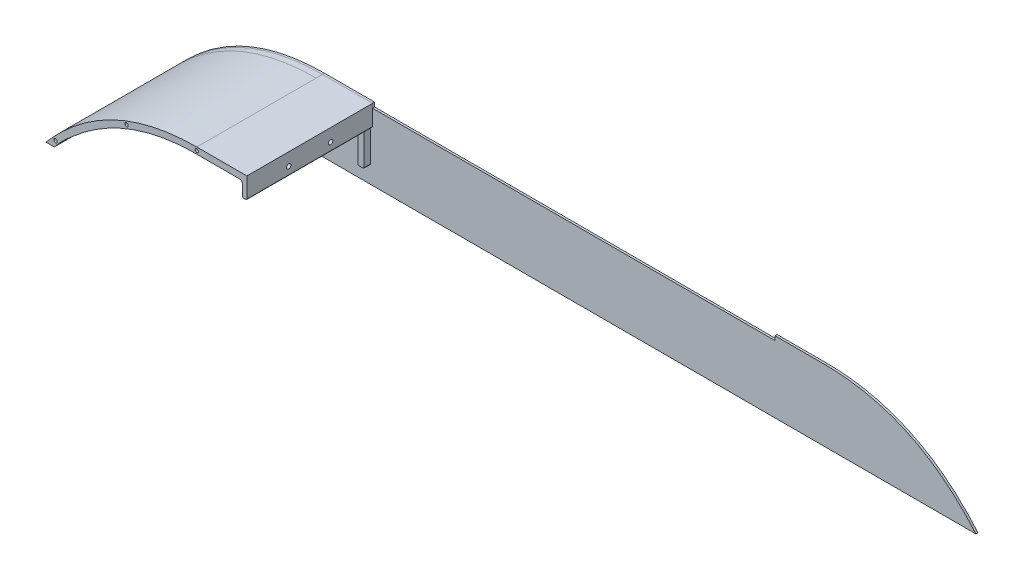
from build123d import *

# Parameters (mm, degrees)
BOSS_EXTRUDE1_DEPTH = 3.175
CUT_EXTRUDE1_DEPTH  = 921.755474233
BOSS_EXTRUDE2_DEPTH = 9.525
BOSS_EXTRUDE3_DEPTH = 180.975
SKETCH6_W           = 28.082698006
SKETCH6_H           = 28.575
CUT_EXTRUDE2_DEPTH  = 9.525
SKETCH7_R           = 3.275
CUT_EXTRUDE3_DEPTH  = 939.366939617
SKETCH8_R           = 3.325
CUT_EXTRUDE5_DEPTH  = 6.35
SKETCH9_R           = 2.6
SKETCH9_R_2         = 2.600000001
CUT_EXTRUDE6_DEPTH  = 12.7
SKETCH11_R          = 1.9
BOSS_EXTRUDE5_DEPTH = 10.16
SKETCH14_W          = 12.7
SKETCH14_H          = 9.525
BOSS_EXTRUDE8_DEPTH = 57.150234853
SKETCH17_W          = 9.525
SKETCH17_H          = 50.8
CUT_EXTRUDE9_DEPTH  = 3.175
FILLET1_R           = 5
FILLET2_R           = 2
FILLET3_R           = 1
FILLET8_R           = 5
FILLET9_R           = 1.5
FILLET10_R          = 1.5


# Read off the part's stored shape, not the designer's step: Split2
with BuildPart() as part:
    # Sketch1 → Boss-Extrude1 (new body)
    with BuildSketch(Plane.XY):
        with BuildLine():
            Line((0, 0), (-304.8, 0))
            add(Edge.make_bspline(
                [(-304.8, 0), (-213.403997347, 107.359981337), (-76.2, 107.95)],
                knots=[0, 0, 0, 1, 1, 1], degree=2))
            Line((-76.2, 107.95), (0, 107.95))
            Line((0, 107.95), (609.6, 107.95))
            Line((609.6, 107.95), (685.8, 107.95))
            add(Edge.make_bspline(
                [(914.4, 0), (823.003997347, 107.359981337), (685.8, 107.95)],
                knots=[0, 0, 0, 1, 1, 1], degree=2))
            Line((914.4, 0), (609.6, 0))
            Line((609.6, 0), (0, 0))
        make_face()
    extrude(amount=BOSS_EXTRUDE1_DEPTH)

    # Sketch2 → Cut-Extrude1 (cut, through all)
    with BuildSketch(Plane.XY.offset(3.175)):
        Polygon((0, 107.95), (609.6, 107.95), (609.854, 107.95), (609.854, 101.6), (609.6, 101.6), (0, 101.6), (-0.254, 101.6), (-0.254, 107.95), align=None)
    extrude(amount=-CUT_EXTRUDE1_DEPTH, mode=Mode.SUBTRACT)

    # Sketch3 → Boss-Extrude2 (add)
    with BuildSketch(Plane.XY.offset(3.175)):
        with BuildLine():
            Line((-304.8, 0), (-254.508, 0))
            Line((-254.508, 0), (-254.508, 15.344828713))
            add(Edge.make_bspline(
                [(-254.508, 15.344828713), (-177.798332328, 82.893238953), (-76.090773332, 82.550234853)],
                knots=[0, 0, 0, 1, 1, 1], degree=2))
            Line((-76.090773332, 82.550234853), (-6.604, 82.550234853))
            Line((-6.604, 82.550234853), (-6.604, 76.2))
            Line((-6.604, 76.2), (-0.254, 76.2))
            Line((-0.254, 76.2), (-0.254, 107.95))
            Line((-0.254, 107.95), (-76.2, 107.95))
            add(Edge.make_bspline(
                [(-76.2, 107.95), (-213.403997347, 107.359981337), (-304.8, 0)],
                knots=[0, 0, 0, 1, 1, 1], degree=2))
        make_face()
    extrude(amount=BOSS_EXTRUDE2_DEPTH)

    # Sketch5 → Boss-Extrude3 (add)
    with BuildSketch(Plane.XY.offset(12.7)):
        with BuildLine():
            Line((-304.8, 0), (-292.1, 0))
            add(Edge.make_bspline(
                [(-264.999310143, 27.259023461), (-280.043189094, 15.090688978), (-292.1, 0)],
                knots=[0, 0, 0, 1, 1, 1], degree=2))
            add(Edge.make_bspline(
                [(-264.999310143, 27.259023461), (-263.324912471, 28.733451708), (-259.93755133, 31.654735884), (-253.107003874, 37.29977015), (-244.418964995, 44.024448353), (-233.76867915, 51.547177424), (-219.265929961, 60.847632169), (-200.578257731, 71.093058658), (-177.28374589, 81.152323376), (-153.155325898, 88.956116173), (-132.386582303, 93.571898544), (-115.39333326, 96.133277835), (-102.464741628, 97.490056952), (-91.537068573, 98.151901873), (-82.713415498, 98.401217113), (-78.259134389, 98.432637828), (-76.037235922, 98.425144577)],
                knots=[0.49783188, 0.49783188, 0.49783188, 0.49783188, 0.497964782, 0.498097684, 0.498363488, 0.498629292, 0.498895096, 0.499426703, 0.499958311, 0.500489919, 0.501021527, 0.501287331, 0.501553135, 0.501818938, 0.50195184, 0.502084742, 0.502084742, 0.502084742, 0.502084742], degree=3))
            Line((-76.037235922, 98.425144577), (-6.604, 98.425144577))
            Line((-6.604, 98.425144577), (-6.604, 82.550234853))
            Line((-6.604, 82.550234853), (-6.604, 76.2))
            Line((-6.604, 76.2), (-0.254, 76.2))
            Line((-0.254, 76.2), (-0.254, 107.95))
            Line((-0.254, 107.95), (-76.199999999, 107.95))
            add(Edge.make_bspline(
                [(-76.199999999, 107.95), (-213.403997347, 107.359981337), (-304.8, 0)],
                knots=[0, 0, 0, 1, 1, 1], degree=2))
        make_face()
    extrude(amount=BOSS_EXTRUDE3_DEPTH)

    # Sketch6 → Cut-Extrude2 (cut)
    with BuildSketch(Plane.XY.offset(12.7)):
        with Locations((-240.466650997, 14.2875)):
            Rectangle(SKETCH6_W, SKETCH6_H)
    extrude(amount=-CUT_EXTRUDE2_DEPTH, mode=Mode.SUBTRACT)

    # Sketch7 → Cut-Extrude3 (cut, through all)
    with BuildSketch(Plane.XY.offset(12.7)):
        with Locations((-267.208, 10.16)):
            Circle(SKETCH7_R)
        with Locations((-175.365808452, 72.622269579)):
            Circle(SKETCH7_R)
        with Locations((-57.404, 90.17019152)):
            Circle(SKETCH7_R)
    extrude(amount=-CUT_EXTRUDE3_DEPTH, mode=Mode.SUBTRACT)

    # Sketch8 → Cut-Extrude5 (cut)
    with BuildSketch(Plane(origin=(-0.254, 0, 0), x_dir=(0, 0, -1), z_dir=(1, 0, 0))):
        with Locations((-66.675, 88.9)):
            Circle(SKETCH8_R)
        with Locations((-130.175, 88.9)):
            Circle(SKETCH8_R)
    extrude(amount=-CUT_EXTRUDE5_DEPTH, mode=Mode.SUBTRACT)

    # Sketch9 → Cut-Extrude6 (cut)
    with BuildSketch(Plane.XY.offset(193.675)):
        with Locations((-290.370830702, 9.142552388)):
            Circle(SKETCH9_R)
        with Locations((-182.759356376, 83.816480509)):
            Circle(SKETCH9_R)
        with Locations((-76.179788765, 103.250043457)):
            Circle(SKETCH9_R_2)
    extrude(amount=-CUT_EXTRUDE6_DEPTH, mode=Mode.SUBTRACT)

    # Sketch11 → Boss-Extrude5 (add)
    with BuildSketch(Plane(origin=(-254.508, 2e-09, 0), x_dir=(0, 0, -1), z_dir=(1.0, -6.037741648177811e-12, 0))):
        with Locations(Location((-7.1374, 3.975099998, 0), (0, 0, 270))):
            Circle(SKETCH11_R)
        with Locations(Location((-7.1374, 21.425099998, 0), (0, 0, 270))):
            Circle(SKETCH11_R)
    extrude(amount=BOSS_EXTRUDE5_DEPTH)

    # Sketch14 → Boss-Extrude8 (add)
    with BuildSketch(Plane.XZ.offset(-82.550234853)):
        with Locations((-6.604, 7.9375)):
            Rectangle(SKETCH14_W, SKETCH14_H)
    extrude(amount=BOSS_EXTRUDE8_DEPTH)

    # Sketch17 → Cut-Extrude9 (cut)
    with BuildSketch(Plane(origin=(-0.254, 0, 0), x_dir=(0, 0, -1), z_dir=(1, 0, 0))):
        with Locations((-7.9375, 50.8)):
            Rectangle(SKETCH17_W, SKETCH17_H)
    extrude(amount=-CUT_EXTRUDE9_DEPTH, mode=Mode.SUBTRACT)

    # Fillet1
    fillet1_edges = [part.edges().sort_by_distance(p)[0] for p in [
        (-6.604, 98.425144577, 103.1875),
    ]]
    fillet(fillet1_edges, radius=FILLET1_R)

    # Fillet2
    fillet2_edges = [part.edges().sort_by_distance(p)[0] for p in [
        (-238.394170448, 28.575, 7.9375),
        (-254.508, 28.575, 7.9375),
    ]]
    fillet(fillet2_edges, radius=FILLET2_R)

    # Fillet3
    # the kernel refuses this fillet: 1 mm, written as the material it takes off along each edge
    with BuildSketch(Plane(origin=(-292.1, 0, 12.7), x_dir=(0.6252400597778598, 0.7804324875663354, 0), z_dir=(0, 0, 1))) as fillet3_piece_1:
        with BuildLine():
            CenterArc((0.480195921, 0.999999109), FILLET3_R, 218.699809372, 51.223710378)
            Line((-0.300236566, 0.374759049), (-0.315845216, 0.362254248))
            Line((-0.315845216, 0.362254248), (-0.01560865, -0.012504801))
            Line((-0.01560865, -0.012504801), (2.669e-05, -0.019999982))
            ThreePointArc((2.669e-05, -0.019999982), (0.239430546, -0.019840221), (0.478834393, -0.019999982))
            Line((0.478834393, -0.019999982), (0.478861089, 0))
        make_face()
    extrude(amount=180.975, mode=Mode.SUBTRACT)

    # Fillet8
    fillet8_edges = [part.edges().sort_by_distance(p)[0] for p in [
        (-12.954, 82.550234853, 7.9375),
    ]]
    fillet(fillet8_edges, radius=FILLET8_R)

    # Fillet9
    fillet9_edges = [part.edges().sort_by_distance(p)[0] for p in [
        (-12.954, 25.4, 7.9375),
        (-3.429, 25.4, 7.9375),
        (-6.604, 76.2, 103.1875),
        (-0.254, 76.2, 98.425),
    ]]
    fillet(fillet9_edges, radius=FILLET9_R)

    # Fillet10
    fillet10_edges = [part.edges().sort_by_distance(p)[0] for p in [
        (-3.429, 76.2, 7.9375),
    ]]
    fillet(fillet10_edges, radius=FILLET10_R)


with BuildPart() as body_2:
    # Split2: the piece on the far side of the plane
    add(part.part)
    split(bisect_by=Plane.XY.offset(3.175), keep=Keep.BOTTOM)


with BuildPart() as part_1:
    add(part.part)

    # Split2
    split(bisect_by=Plane.XY.offset(3.175), keep=Keep.TOP)


solid = Compound([body_2.part, part_1.part])
